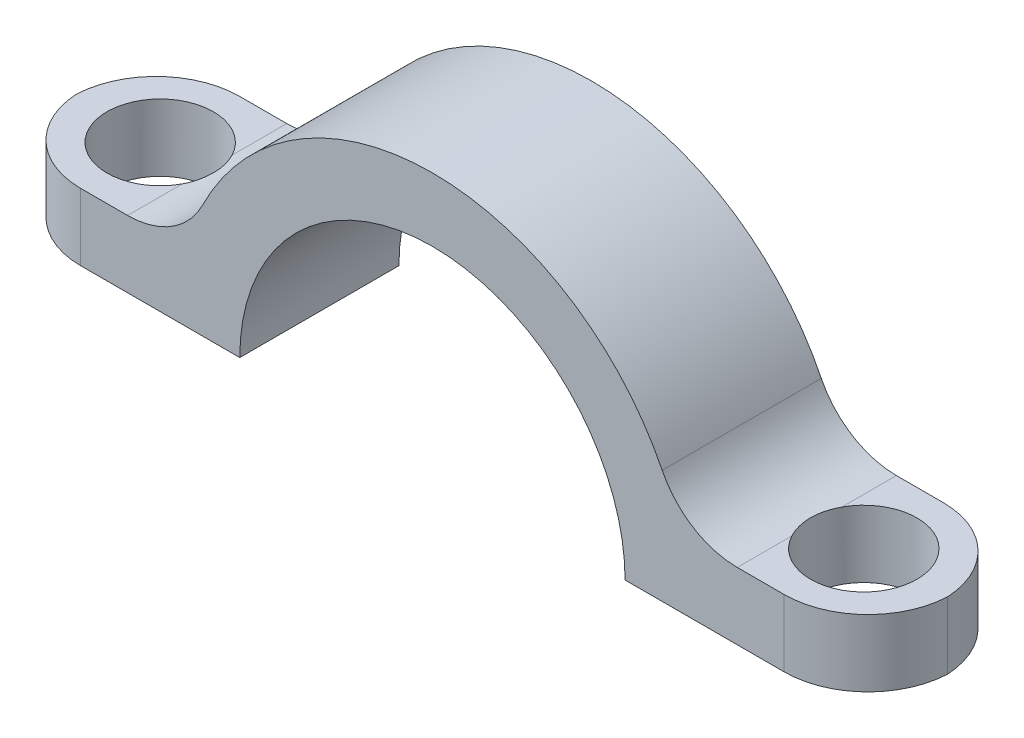
from build123d import *

# Parameters (mm, degrees)
BOSS_EXTRUDE1_DEPTH     = 9.5
FILLET5_R               = 5
CUT_EXTRUDE1_DEPTH      = 30.898829409
CUT_EXTRUDE1_DEPTH_BACK = 30.898829409
SKETCH2_R               = 3.175
FILLET1_R               = 5


with BuildPart() as part:
    # Sketch1 → Boss-Extrude1 (new body)
    with BuildSketch(Plane.XY):
        with BuildLine():
            Line((11.5, 0), (26, 0))
            Line((26, 0), (26, 4))
            Line((26, 4), (14.76787053, 4))
            ThreePointArc((14.76787053, 4), (0, 15.3), (-14.76787053, 4))
            Line((-14.76787053, 4), (-26, 4))
            Line((-26, 4), (-26, 0))
            Line((-26, 0), (-11.5, 0))
            ThreePointArc((-11.5, 0), (0, 11.5), (11.5, 0))
        make_face()
    extrude(amount=BOSS_EXTRUDE1_DEPTH)

    # Fillet5
    fillet5_edges = [part.edges().sort_by_distance(p)[0] for p in [
        (-14.76787053, 4, 4.75),
        (14.76787053, 4, 4.75),
    ]]
    fillet(fillet5_edges, radius=FILLET5_R)

    # Sketch2 → Cut-Extrude1 (cut, two sides: drawn at the far end of the back side and taken through both)
    with BuildSketch(Plane(origin=(0, 4, 0), x_dir=(1, 0, 0), z_dir=(0, 1, 0)).offset(-CUT_EXTRUDE1_DEPTH_BACK)):
        with Locations(Location((-21, -4.75, 0), (0, 0, 270))):
            Circle(SKETCH2_R)
        with Locations(Location((21, -4.75, 0), (0, 0, 270))):
            Circle(SKETCH2_R)
    extrude(amount=CUT_EXTRUDE1_DEPTH + CUT_EXTRUDE1_DEPTH_BACK, mode=Mode.SUBTRACT)

    # Fillet1
    # the kernel refuses this fillet: 5 mm, written as the material it takes off along each edge
    with BuildSketch(Plane(origin=(-26, 16.5, 0), x_dir=(1, 0, 0), z_dir=(0, -1, 0))) as fillet1_piece_1:
        with BuildLine():
            CenterArc((FILLET1_R, FILLET1_R), FILLET1_R, 180, 90)
            Line((0, FILLET1_R), (0, 0))
            Line((0, 0), (FILLET1_R, 0))
        make_face()
    extrude(amount=29, mode=Mode.SUBTRACT)
    with BuildSketch(Plane(origin=(26, -12.5, 0), x_dir=(0, 0, 1), z_dir=(0, 1, 0)), Plane(origin=(26, -12.5, 9.5), x_dir=(-1, 0, 0), z_dir=(0, 1, 0)), Plane(origin=(-26, 16.5, 9.5), x_dir=(1, 0, 0), z_dir=(0, -1, 0))) as fillet1_piece_2:
        with BuildLine():
            CenterArc((FILLET1_R, -FILLET1_R), FILLET1_R, 90, 90)
            Line((0, -FILLET1_R), (0, 0))
            Line((0, 0), (FILLET1_R, 0))
        make_face()
    extrude(amount=29, mode=Mode.SUBTRACT)


solid = part.part
